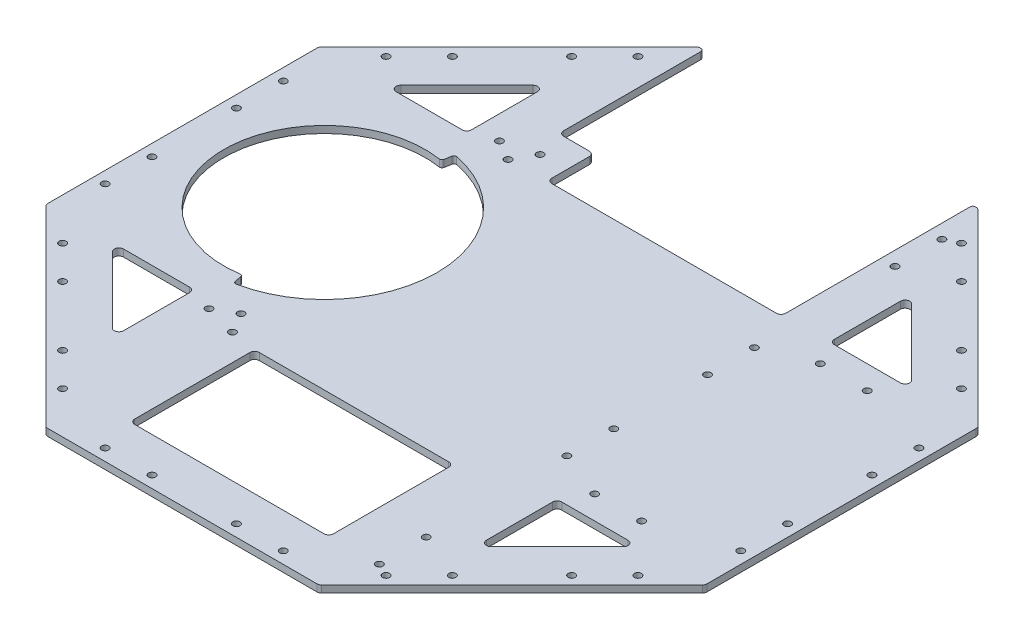
from build123d import *

# Parameters (mm, degrees)
EXTRUDE_1_DEPTH        = 3
SKETCH_6_W             = 15
SKETCH_6_H             = 20
SKETCH_6_W_2           = 84.80502971
SKETCH_6_H_2           = 53.179415022
EXTRUDE_2_DEPTH        = 3
SKETCH_2_R             = 1.5
CUT_EXTRUDE_1_DEPTH    = 10
SKETCH_3_R             = 43
CUT_EXTRUDE_2_DEPTH    = 10
SKETCH_4_R             = 1.5
CUT_EXTRUDE_3_DEPTH    = 10
SKETCH_7_R             = 1.5
CUT_EXTRUDE_4_DEPTH    = 10
CUT_EXTRUDE_5_DEPTH    = 10
SKETCH_9_R             = 1.5
CUT_EXTRUDE_6_DEPTH    = 10
FILLET_1_R             = 2
CUT_EXTRUDE_7614_DEPTH = 10
FILLET_2_R             = 1


with BuildPart() as part:
    # 草图1 → 凸台-拉伸1 (new body)
    with BuildSketch(Plane(origin=(0, 0, 0), x_dir=(1, 0, 0), z_dir=(0, 1, 0))):
        Polygon((-57.402514855, -57.402514855), (57.402514855, -57.402514855), (57.402514855, -138.581929877), (58.816728417, -139.996143439), (140.581929877, -58.23094198), (140.581929877, 58.23094198), (58.816728417, 139.996143439), (57.402514855, 138.581929877), (57.402514855, 57.402514855), (-57.402514855, 57.402514855), (-57.402514855, 138.581929877), (-58.816728417, 139.996143439), (-140.581929877, 58.23094198), (-140.581929877, -58.23094198), (-58.816728417, -139.996143439), (-57.402514855, -138.581929877), align=None)
    extrude(amount=EXTRUDE_1_DEPTH)

    # 草图6 → 凸台-拉伸2 (add)
    # profile 1 of 2: a face of its own
    with BuildSketch(Plane(origin=(0, 3, 0), x_dir=(1, 0, 0), z_dir=(0, 1, 0))):
        with Locations((-49.902514855, 67.402514855)):
            Rectangle(SKETCH_6_W, SKETCH_6_H)
    # profile 2 of 2: a face of its own
    with BuildSketch(Plane(origin=(0, 3, 0), x_dir=(1, 0, 0), z_dir=(0, 1, 0))):
        Polygon((-58.816728417, -139.996143439), (-58.23094198, -140.581929877), (58.23094198, -140.581929877), (58.816728417, -139.996143439), (57.402514855, -138.581929877), (57.402514855, -57.402514855), (-57.402514855, -57.402514855), (-57.402514855, -138.581929877), align=None)
        with Locations((0, -93.992222366)):
            Rectangle(SKETCH_6_W_2, SKETCH_6_H_2, mode=Mode.SUBTRACT)
    extrude(amount=-EXTRUDE_2_DEPTH)

    # 草图2 → 切除-拉伸1 (cut)
    with BuildSketch(Plane(origin=(0, 3, 0), x_dir=(1, 0, 0), z_dir=(0, 1, 0))):
        with Locations(Location((-135.581929877, 18, 0), (0, 0, 270))):
            Circle(SKETCH_2_R)
        with Locations(Location((-135.581929877, 38, 0), (0, 0, 270))):
            Circle(SKETCH_2_R)
        with Locations(Location((-135.581929877, -18, 0), (0, 0, 270))):
            Circle(SKETCH_2_R)
        with Locations(Location((-135.581929877, -38, 0), (0, 0, 270))):
            Circle(SKETCH_2_R)
        with Locations(Location((135.581929877, -38, 0), (0, 0, 270))):
            Circle(SKETCH_2_R)
        with Locations(Location((135.581929877, -18, 0), (0, 0, 270))):
            Circle(SKETCH_2_R)
        with Locations(Location((135.581929877, 38, 0), (0, 0, 270))):
            Circle(SKETCH_2_R)
        with Locations(Location((135.581929877, 18, 0), (0, 0, 270))):
            Circle(SKETCH_2_R)
        with Locations(Location((-83.142979961, 108.598824084, 0), (0, 0, 270))):
            Circle(SKETCH_2_R)
        with Locations(Location((-69.000844337, 122.740959707, 0), (0, 0, 270))):
            Circle(SKETCH_2_R)
        with Locations(Location((-108.598824084, 83.142979961, 0), (0, 0, 270))):
            Circle(SKETCH_2_R)
        with Locations(Location((-122.740959707, 69.000844337, 0), (0, 0, 270))):
            Circle(SKETCH_2_R)
        with Locations(Location((69.000844337, -122.740959707, 0), (0, 0, 270))):
            Circle(SKETCH_2_R)
        with Locations(Location((83.142979961, -108.598824084, 0), (0, 0, 270))):
            Circle(SKETCH_2_R)
        with Locations(Location((122.740959707, -69.000844337, 0), (0, 0, 270))):
            Circle(SKETCH_2_R)
        with Locations(Location((108.598824084, -83.142979961, 0), (0, 0, 270))):
            Circle(SKETCH_2_R)
        with Locations((18, 135.581929877)):
            Circle(SKETCH_2_R)
        with Locations((38, 135.581929877)):
            Circle(SKETCH_2_R)
        with Locations((-18, 135.581929877)):
            Circle(SKETCH_2_R)
        with Locations((-38, 135.581929877)):
            Circle(SKETCH_2_R)
        with Locations(Location((-38, -135.581929877, 0), (0, 0, 270))):
            Circle(SKETCH_2_R)
        with Locations(Location((-18, -135.581929877, 0), (0, 0, 270))):
            Circle(SKETCH_2_R)
        with Locations(Location((38, -135.581929877, 0), (0, 0, 270))):
            Circle(SKETCH_2_R)
        with Locations(Location((18, -135.581929877, 0), (0, 0, 270))):
            Circle(SKETCH_2_R)
        with Locations(Location((108.598824084, 83.142979961, 0), (0, 0, 270))):
            Circle(SKETCH_2_R)
        with Locations(Location((122.740959707, 69.000844337, 0), (0, 0, 270))):
            Circle(SKETCH_2_R)
        with Locations(Location((83.142979961, 108.598824084, 0), (0, 0, 270))):
            Circle(SKETCH_2_R)
        with Locations(Location((69.000844337, 122.740959707, 0), (0, 0, 270))):
            Circle(SKETCH_2_R)
        with Locations(Location((-122.740959707, -69.000844337, 0), (0, 0, 270))):
            Circle(SKETCH_2_R)
        with Locations(Location((-108.598824084, -83.142979961, 0), (0, 0, 270))):
            Circle(SKETCH_2_R)
        with Locations(Location((-69.000844337, -122.740959707, 0), (0, 0, 270))):
            Circle(SKETCH_2_R)
        with Locations(Location((-83.142979961, -108.598824084, 0), (0, 0, 270))):
            Circle(SKETCH_2_R)
    extrude(amount=-CUT_EXTRUDE_1_DEPTH, mode=Mode.SUBTRACT)

    # 草图3 → 切除-拉伸2 (cut)
    with BuildSketch(Plane(origin=(0, 3, 0), x_dir=(1, 0, 0), z_dir=(0, 1, 0))):
        with Locations(Location((-80, 0, 0), (0, 0, 270))):
            Circle(SKETCH_3_R)
    extrude(amount=-CUT_EXTRUDE_2_DEPTH, mode=Mode.SUBTRACT)

    # 草图4 → 切除-拉伸3 (cut)
    with BuildSketch(Plane(origin=(0, 3, 0), x_dir=(1, 0, 0), z_dir=(0, 1, 0))):
        with Locations(Location((-58.660254038, -56.961524227, 0), (0, 0, 270))):
            Circle(SKETCH_4_R)
        with Locations(Location((-67.320508076, -61.961524227, 0), (0, 0, 270))):
            Circle(SKETCH_4_R)
        with Locations(Location((-53.660254038, -65.621778265, 0), (0, 0, 270))):
            Circle(SKETCH_4_R)
        with Locations(Location((-53.660254038, 65.621778265, 0), (0, 0, 270))):
            Circle(SKETCH_4_R)
        with Locations(Location((-58.660254038, 56.961524227, 0), (0, 0, 270))):
            Circle(SKETCH_4_R)
        with Locations(Location((-67.320508076, 61.961524227, 0), (0, 0, 270))):
            Circle(SKETCH_4_R)
    extrude(amount=-CUT_EXTRUDE_3_DEPTH, mode=Mode.SUBTRACT)

    # 草图7 → 切除-拉伸4 (cut)
    with BuildSketch(Plane(origin=(0, 3, 0), x_dir=(1, 0, 0), z_dir=(0, 1, 0))):
        with Locations(Location((63.402514855, 120, 0), (0, 0, 270))):
            Circle(SKETCH_7_R)
        with Locations(Location((63.402514855, 100, 0), (0, 0, 270))):
            Circle(SKETCH_7_R)
        with Locations(Location((63.402514855, 40, 0), (0, 0, 270))):
            Circle(SKETCH_7_R)
        with Locations(Location((63.402514855, 20, 0), (0, 0, 270))):
            Circle(SKETCH_7_R)
        with Locations(Location((63.402514855, -20, 0), (0, 0, 270))):
            Circle(SKETCH_7_R)
        with Locations(Location((63.402514855, -40, 0), (0, 0, 270))):
            Circle(SKETCH_7_R)
        with Locations(Location((63.402514855, -100, 0), (0, 0, 270))):
            Circle(SKETCH_7_R)
        with Locations(Location((63.402514855, -120, 0), (0, 0, 270))):
            Circle(SKETCH_7_R)
    extrude(amount=-CUT_EXTRUDE_4_DEPTH, mode=Mode.SUBTRACT)

    # 草图8 → 切除-拉伸5 (cut)
    with BuildSketch(Plane(origin=(0, 3, 0), x_dir=(1, 0, 0), z_dir=(0, 1, 0))):
        Polygon((77.402514855, -58.126085754), (77.402514855, -93.126085754), (112.402514855, -58.126085754), align=None)
        Polygon((-77.402514855, -93.126085754), (-112.402514855, -58.126085754), (-77.402514855, -58.126085754), align=None)
        Polygon((77.402514855, 93.126085754), (112.402514855, 58.126085754), (77.402514855, 58.126085754), align=None)
        Polygon((-77.402514855, 58.126085754), (-77.402514855, 93.126085754), (-112.402514855, 58.126085754), align=None)
    extrude(amount=-CUT_EXTRUDE_5_DEPTH, mode=Mode.SUBTRACT)

    # 草图9 → 切除-拉伸6 (cut)
    with BuildSketch(Plane(origin=(0, 3, 0), x_dir=(1, 0, 0), z_dir=(0, 1, 0))):
        with Locations(Location((83.402514855, -48.126085754, 0), (0, 0, 270))):
            Circle(SKETCH_9_R)
        with Locations(Location((103.402514855, -48.126085754, 0), (0, 0, 270))):
            Circle(SKETCH_9_R)
        with Locations(Location((103.402514855, 48.126085754, 0), (0, 0, 270))):
            Circle(SKETCH_9_R)
        with Locations(Location((83.402514855, 48.126085754, 0), (0, 0, 270))):
            Circle(SKETCH_9_R)
    extrude(amount=-CUT_EXTRUDE_6_DEPTH, mode=Mode.SUBTRACT)

    # 圆角1
    # the kernel refuses this fillet: 2 mm, written as the material it adds along each edge
    with BuildSketch(Plane(origin=(-42.402514855, 3, 67.402514855), x_dir=(1, 0, 0), z_dir=(0, -1, 0)), Plane(origin=(42.402514855, 3, 67.402514855), x_dir=(0, 0, 1), z_dir=(0, -1, 0)), Plane(origin=(57.402514855, 0, -57.402514855), x_dir=(0, 0, -1), z_dir=(0, 1, 0)), Plane(origin=(77.402514855, 3, -58.126085754), x_dir=(0, 0, -1), z_dir=(0, -1, 0)), Plane(origin=(-77.402514855, 3, 58.126085754), x_dir=(0, 0, 1), z_dir=(0, -1, 0))) as fillet_1_piece_1:
        with BuildLine():
            CenterArc((FILLET_1_R, FILLET_1_R), FILLET_1_R, 180, 90)
            Line((0, FILLET_1_R), (0, 0))
            Line((0, 0), (FILLET_1_R, 0))
        make_face()
    extrude(amount=3)
    with BuildSketch(Plane(origin=(-42.402514855, 3, 120.581929877), x_dir=(1, 0, 0), z_dir=(0, -1, 0)), Plane(origin=(42.402514855, 3, 120.581929877), x_dir=(0, 0, -1), z_dir=(0, -1, 0)), Plane(origin=(-57.402514855, 3, -77.402514855), x_dir=(1, 0, 0), z_dir=(0, -1, 0)), Plane(origin=(-42.402514855, 3, -57.402514855), x_dir=(1, 0, 0), z_dir=(0, -1, 0)), Plane(origin=(77.402514855, 3, 58.126085754), x_dir=(0, 0, 1), z_dir=(0, -1, 0)), Plane(origin=(-77.402514855, 3, -58.126085754), x_dir=(0, 0, -1), z_dir=(0, -1, 0))) as fillet_1_piece_2:
        with BuildLine():
            CenterArc((FILLET_1_R, -FILLET_1_R), FILLET_1_R, 90, 90)
            Line((0, -FILLET_1_R), (0, 0))
            Line((0, 0), (FILLET_1_R, 0))
        make_face()
    extrude(amount=3)
    with BuildSketch(Plane(origin=(77.402514855, 3, 93.126085754), x_dir=(0, 0, -1), z_dir=(0, -1, 0)), Plane(origin=(-77.402514855, 3, -93.126085754), x_dir=(0, 0, 1), z_dir=(0, -1, 0)), Plane(origin=(112.402514855, 3, -58.126085754), x_dir=(-1, 0, 0), z_dir=(0, -1, 0)), Plane(origin=(-112.402514855, 3, 58.126085754), x_dir=(1, 0, 0), z_dir=(0, -1, 0))) as fillet_1_piece_3:
        with BuildLine():
            CenterArc((FILLET_1_R * 2.41421356237, FILLET_1_R), FILLET_1_R, 135, 135)
            Line((FILLET_1_R * 1.70710678119, FILLET_1_R * 1.70710678119), (0, 0))
            Line((0, 0), (FILLET_1_R * 2.41421356237, 0))
        make_face()
    extrude(amount=3)
    with BuildSketch(Plane(origin=(112.402514855, 3, 58.126085754), x_dir=(-1, 0, 0), z_dir=(0, -1, 0)), Plane(origin=(-112.402514855, 3, -58.126085754), x_dir=(1, 0, 0), z_dir=(0, -1, 0)), Plane(origin=(77.402514855, 3, -93.126085754), x_dir=(0, 0, 1), z_dir=(0, -1, 0)), Plane(origin=(-77.402514855, 3, 93.126085754), x_dir=(0, 0, -1), z_dir=(0, -1, 0))) as fillet_1_piece_4:
        with BuildLine():
            CenterArc((FILLET_1_R * 2.41421356237, -FILLET_1_R), FILLET_1_R, 90, 135)
            Line((FILLET_1_R * 1.70710678119, -FILLET_1_R * 1.70710678119), (0, 0))
            Line((0, 0), (FILLET_1_R * 2.41421356237, 0))
        make_face()
    extrude(amount=3)
    # the kernel refuses this fillet: 2 mm, written as the material it takes off along each edge
    with BuildSketch(Plane(origin=(-58.23094198, 5.071067812, 140.581929877), x_dir=(1, 0, 0), z_dir=(0, -1, 0)), Plane(origin=(57.402514855, -2.071067812, -138.581929877), x_dir=(0.7071067811865475, 0, -0.7071067811865475), z_dir=(0, 1, 0)), Plane(origin=(140.581929877, -2.071067812, -58.23094198), x_dir=(0, 0, 1), z_dir=(0, 1, 0)), Plane(origin=(58.23094198, 5.071067812, 140.581929877), x_dir=(0.7071067811865304, 0, -0.7071067811865647), z_dir=(0, -1, 0)), Plane(origin=(140.581929877, -2.071067812, 58.23094198), x_dir=(-0.7071067811865518, 0, 0.7071067811865432), z_dir=(0, 1, 0))) as fillet_1_2_piece_1:
        with BuildLine():
            CenterArc((FILLET_1_R * 0.414213562373, -FILLET_1_R), FILLET_1_R, 90, 45)
            Line((-FILLET_1_R * 0.292893218813, -FILLET_1_R * 0.292893218813), (0, 0))
            Line((0, 0), (FILLET_1_R * 0.414213562373, 0))
        make_face()
    extrude(amount=7.142135624, mode=Mode.SUBTRACT)
    with BuildSketch(Plane(origin=(-140.581929877, -2.071067812, 58.23094198), x_dir=(0.7071067811865475, 0, 0.7071067811865475), z_dir=(0, 1, 0)), Plane(origin=(-140.581929877, -2.071067812, -58.23094198), x_dir=(0, 0, 1), z_dir=(0, 1, 0)), Plane(origin=(-57.402514855, -2.071067812, -138.581929877), x_dir=(-0.7071067811865561, 0, -0.707106781186539), z_dir=(0, 1, 0))) as fillet_1_2_piece_2:
        with BuildLine():
            CenterArc((FILLET_1_R * 0.414213562373, FILLET_1_R), FILLET_1_R, 225, 45)
            Line((-FILLET_1_R * 0.292893218813, FILLET_1_R * 0.292893218813), (0, 0))
            Line((0, 0), (FILLET_1_R * 0.414213562373, 0))
        make_face()
    extrude(amount=7.142135624, mode=Mode.SUBTRACT)
    with BuildSketch(Plane(origin=(-58.816728417, -5, -139.996143439), x_dir=(-0.7071067811865458, 0, 0.7071067811865493), z_dir=(0, 1, 0)), Plane(origin=(-42.402514855, 8, -77.402514855), x_dir=(0, 0, 1), z_dir=(0, -1, 0))) as fillet_1_2_piece_3:
        with BuildLine():
            CenterArc((FILLET_1_R, FILLET_1_R), FILLET_1_R, 180, 90)
            Line((0, FILLET_1_R), (0, 0))
            Line((0, 0), (FILLET_1_R, 0))
        make_face()
    extrude(amount=13, mode=Mode.SUBTRACT)
    with BuildSketch(Plane(origin=(58.816728417, -5, -139.996143439), x_dir=(0.7071067811865458, 0, 0.7071067811865493), z_dir=(0, 1, 0))) as fillet_1_2_piece_4:
        with BuildLine():
            CenterArc((FILLET_1_R, -FILLET_1_R), FILLET_1_R, 90, 90)
            Line((0, -FILLET_1_R), (0, 0))
            Line((0, 0), (FILLET_1_R, 0))
        make_face()
    extrude(amount=13, mode=Mode.SUBTRACT)

    # 草图10 → Cut-Extrude 7614 (cut)
    with BuildSketch(Plane(origin=(0, 3, 0), x_dir=(1, 0, 0), z_dir=(0, 1, 0))):
        with BuildLine():
            Line((-71.664887472, 47.270772145), (-80, 0))
            Line((-80, 0), (-71.664887472, -47.270772145))
            ThreePointArc((-71.664887472, -47.270772145), (-32, 0), (-71.664887472, 47.270772145))
        make_face()
    extrude(amount=-CUT_EXTRUDE_7614_DEPTH, mode=Mode.SUBTRACT)

    # 圆角2
    fillet_2_edges = [part.edges().sort_by_distance(p)[0] for p in [
        (-72.53312836, 1.5, -42.34673338),
        (-72.53312836, 1.5, 42.34673338),
        (-71.664887472, 1.5, -47.270772145),
        (-71.664887472, 1.5, 47.270772145),
    ]]
    fillet(fillet_2_edges, radius=FILLET_2_R)


solid = part.part
